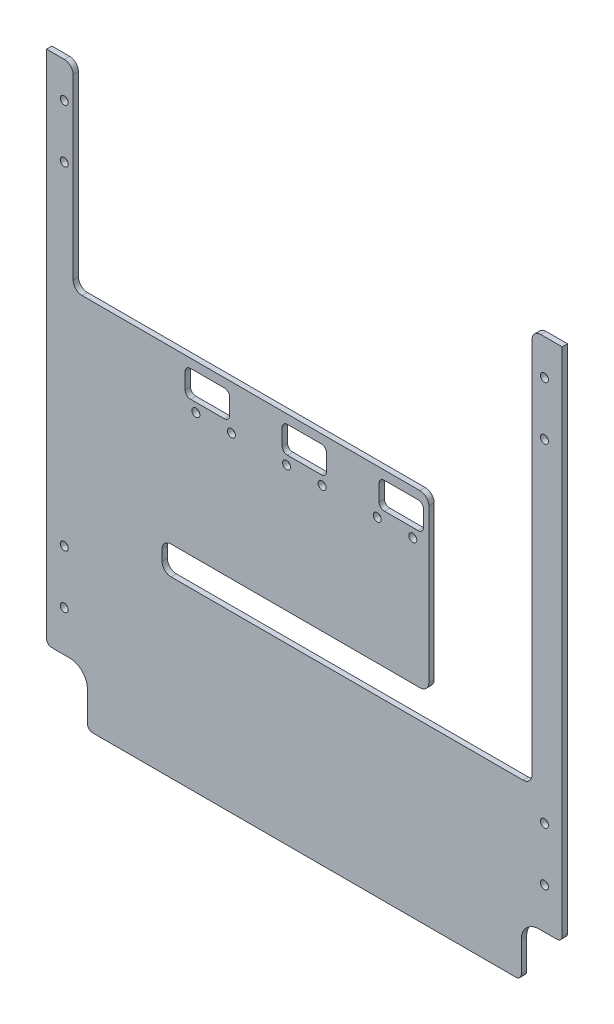
from build123d import *

# Parameters (mm, degrees)
ESQUISSE1_W                  = 290
ESQUISSE1_H                  = 320
BOSS_EXTRU_1_DEPTH           = 3
ENL_V_MAT_EXTRU_1_DEPTH      = 432.866877637
ENL_V_MAT_EXTRU_1_DEPTH_BACK = 432.866877637
ESQUISSE2_W                  = 23
ESQUISSE2_H                  = 30
CONG_1_R                     = 10
CONG_2_R                     = 3
ENL_V_MAT_EXTRU_2_DEPTH      = 432.866877637
ENL_V_MAT_EXTRU_2_DEPTH_BACK = 432.866877637
ESQUISSE3_W                  = 140
ESQUISSE3_H                  = 110
ENL_V_MAT_EXTRU_3_DEPTH      = 432.866877637
ENL_V_MAT_EXTRU_3_DEPTH_BACK = 432.866877637
ESQUISSE4_W                  = 58
ESQUISSE4_H                  = 222
ENL_V_MAT_EXTRU_4_DEPTH      = 432.866877637
ENL_V_MAT_EXTRU_4_DEPTH_BACK = 432.866877637
ESQUISSE5_W                  = 60
ESQUISSE5_H                  = 110
ENL_V_MAT_EXTRU_5_DEPTH      = 432.866877637
ENL_V_MAT_EXTRU_5_DEPTH_BACK = 432.866877637
ESQUISSE6_W                  = 150
ESQUISSE6_H                  = 16
CONG_3_R                     = 5
ENL_V_MAT_EXTRU_6_DEPTH      = 432.866877637
ENL_V_MAT_EXTRU_6_DEPTH_BACK = 432.866877637
ESQUISSE7_R                  = 2.25
ENL_V_MAT_EXTRU_7_DEPTH      = 432.866877637
ENL_V_MAT_EXTRU_7_DEPTH_BACK = 432.866877637
ESQUISSE8_R                  = 2.25
ENL_V_MAT_EXTRU_8_DEPTH      = 432.866877637
ENL_V_MAT_EXTRU_8_DEPTH_BACK = 432.866877637
ESQUISSE9_W                  = 25
ESQUISSE9_H                  = 15
CONG_4_R                     = 3


with BuildPart() as part:
    # Esquisse1 → Boss.-Extru.1 (new body)
    with BuildSketch(Plane.XY):
        with Locations((145, 160)):
            Rectangle(ESQUISSE1_W, ESQUISSE1_H)
    extrude(amount=BOSS_EXTRU_1_DEPTH)

    # Esquisse2 → Enlèv. mat.-Extru.1 (cut, two sides: drawn at the far end of the back side and taken through both)
    with BuildSketch(Plane.XY.offset(3).offset(-ENL_V_MAT_EXTRU_1_DEPTH_BACK)):
        with Locations((278.5, 15)):
            Rectangle(ESQUISSE2_W, ESQUISSE2_H)
        with Locations((11.5, 15)):
            Rectangle(ESQUISSE2_W, ESQUISSE2_H)
    extrude(amount=ENL_V_MAT_EXTRU_1_DEPTH + ENL_V_MAT_EXTRU_1_DEPTH_BACK, mode=Mode.SUBTRACT)

    # Congé1
    cong_1_edges = [part.edges().sort_by_distance(p)[0] for p in [
        (267, 30, 1.5),
        (23, 30, 1.5),
    ]]
    fillet(cong_1_edges, radius=CONG_1_R)

    # Congé2
    cong_2_edges = [part.edges().sort_by_distance(p)[0] for p in [
        (290, 30, 1.5),
        (0, 30, 1.5),
        (23, 0, 1.5),
        (267, 0, 1.5),
    ]]
    fillet(cong_2_edges, radius=CONG_2_R)

    # Esquisse3 → Enlèv. mat.-Extru.2 (cut, two sides: drawn at the far end of the back side and taken through both)
    with BuildSketch(Plane.XY.offset(3).offset(-ENL_V_MAT_EXTRU_2_DEPTH_BACK)):
        with Locations((145, 265)):
            Rectangle(ESQUISSE3_W, ESQUISSE3_H)
    extrude(amount=ENL_V_MAT_EXTRU_2_DEPTH + ENL_V_MAT_EXTRU_2_DEPTH_BACK, mode=Mode.SUBTRACT)

    # Esquisse4 → Enlèv. mat.-Extru.3 (cut, two sides: drawn at the far end of the back side and taken through both)
    with BuildSketch(Plane.XY.offset(3).offset(-ENL_V_MAT_EXTRU_3_DEPTH_BACK)):
        with Locations((244, 209)):
            Rectangle(ESQUISSE4_W, ESQUISSE4_H)
    extrude(amount=ENL_V_MAT_EXTRU_3_DEPTH + ENL_V_MAT_EXTRU_3_DEPTH_BACK, mode=Mode.SUBTRACT)

    # Esquisse5 → Enlèv. mat.-Extru.4 (cut, two sides: drawn at the far end of the back side and taken through both)
    with BuildSketch(Plane.XY.offset(3).offset(-ENL_V_MAT_EXTRU_4_DEPTH_BACK)):
        with Locations((45, 265)):
            Rectangle(ESQUISSE5_W, ESQUISSE5_H)
    extrude(amount=ENL_V_MAT_EXTRU_4_DEPTH + ENL_V_MAT_EXTRU_4_DEPTH_BACK, mode=Mode.SUBTRACT)

    # Esquisse6 → Enlèv. mat.-Extru.5 (cut, two sides: drawn at the far end of the back side and taken through both)
    with BuildSketch(Plane.XY.offset(3).offset(-ENL_V_MAT_EXTRU_5_DEPTH_BACK)):
        with Locations((140, 106)):
            Rectangle(ESQUISSE6_W, ESQUISSE6_H)
    extrude(amount=ENL_V_MAT_EXTRU_5_DEPTH + ENL_V_MAT_EXTRU_5_DEPTH_BACK, mode=Mode.SUBTRACT)

    # Congé3
    cong_3_edges = [part.edges().sort_by_distance(p)[0] for p in [
        (273, 98, 1.5),
        (65, 98, 1.5),
        (65, 114, 1.5),
        (215, 114, 1.5),
        (215, 210, 1.5),
        (15, 210, 1.5),
        (273, 320, 1.5),
        (15, 320, 1.5),
    ]]
    fillet(cong_3_edges, radius=CONG_3_R)

    # Esquisse7 → Enlèv. mat.-Extru.6 (cut, two sides: drawn at the far end of the back side and taken through both)
    with BuildSketch(Plane.XY.offset(3).offset(-ENL_V_MAT_EXTRU_6_DEPTH_BACK)):
        with Locations((280, 300)):
            Circle(ESQUISSE7_R)
        with Locations((280, 270)):
            Circle(ESQUISSE7_R)
        with Locations((10, 270)):
            Circle(ESQUISSE7_R)
        with Locations((10, 300)):
            Circle(ESQUISSE7_R)
        with Locations((280, 83)):
            Circle(ESQUISSE7_R)
        with Locations((280, 53)):
            Circle(ESQUISSE7_R)
        with Locations((10, 53)):
            Circle(ESQUISSE7_R)
        with Locations((10, 83)):
            Circle(ESQUISSE7_R)
    extrude(amount=ENL_V_MAT_EXTRU_6_DEPTH + ENL_V_MAT_EXTRU_6_DEPTH_BACK, mode=Mode.SUBTRACT)

    # Esquisse8 → Enlèv. mat.-Extru.7 (cut, two sides: drawn at the far end of the back side and taken through both)
    with BuildSketch(Plane.XY.offset(3).offset(-ENL_V_MAT_EXTRU_7_DEPTH_BACK)):
        with Locations((135, 185)):
            Circle(ESQUISSE8_R)
        with Locations((155, 185)):
            Circle(ESQUISSE8_R)
        with Locations((186, 185)):
            Circle(ESQUISSE8_R)
        with Locations((206, 185)):
            Circle(ESQUISSE8_R)
        with Locations((84, 185)):
            Circle(ESQUISSE8_R)
        with Locations((104, 185)):
            Circle(ESQUISSE8_R)
    extrude(amount=ENL_V_MAT_EXTRU_7_DEPTH + ENL_V_MAT_EXTRU_7_DEPTH_BACK, mode=Mode.SUBTRACT)

    # Esquisse9 → Enlèv. mat.-Extru.8 (cut, two sides: drawn at the far end of the back side and taken through both)
    with BuildSketch(Plane.XY.offset(3).offset(-ENL_V_MAT_EXTRU_8_DEPTH_BACK)):
        with Locations((145, 197.5)):
            Rectangle(ESQUISSE9_W, ESQUISSE9_H)
        with Locations((199.5, 197.5)):
            Rectangle(ESQUISSE9_W, ESQUISSE9_H)
        with Locations((90.5, 197.5)):
            Rectangle(ESQUISSE9_W, ESQUISSE9_H)
    extrude(amount=ENL_V_MAT_EXTRU_8_DEPTH + ENL_V_MAT_EXTRU_8_DEPTH_BACK, mode=Mode.SUBTRACT)

    # Congé4
    cong_4_edges = [part.edges().sort_by_distance(p)[0] for p in [
        (157.5, 190, 1.5),
        (157.5, 205, 1.5),
        (132.5, 205, 1.5),
        (132.5, 190, 1.5),
        (212, 190, 1.5),
        (212, 205, 1.5),
        (187, 205, 1.5),
        (187, 190, 1.5),
        (103, 190, 1.5),
        (103, 205, 1.5),
        (78, 205, 1.5),
        (78, 190, 1.5),
    ]]
    fillet(cong_4_edges, radius=CONG_4_R)


solid = part.part
